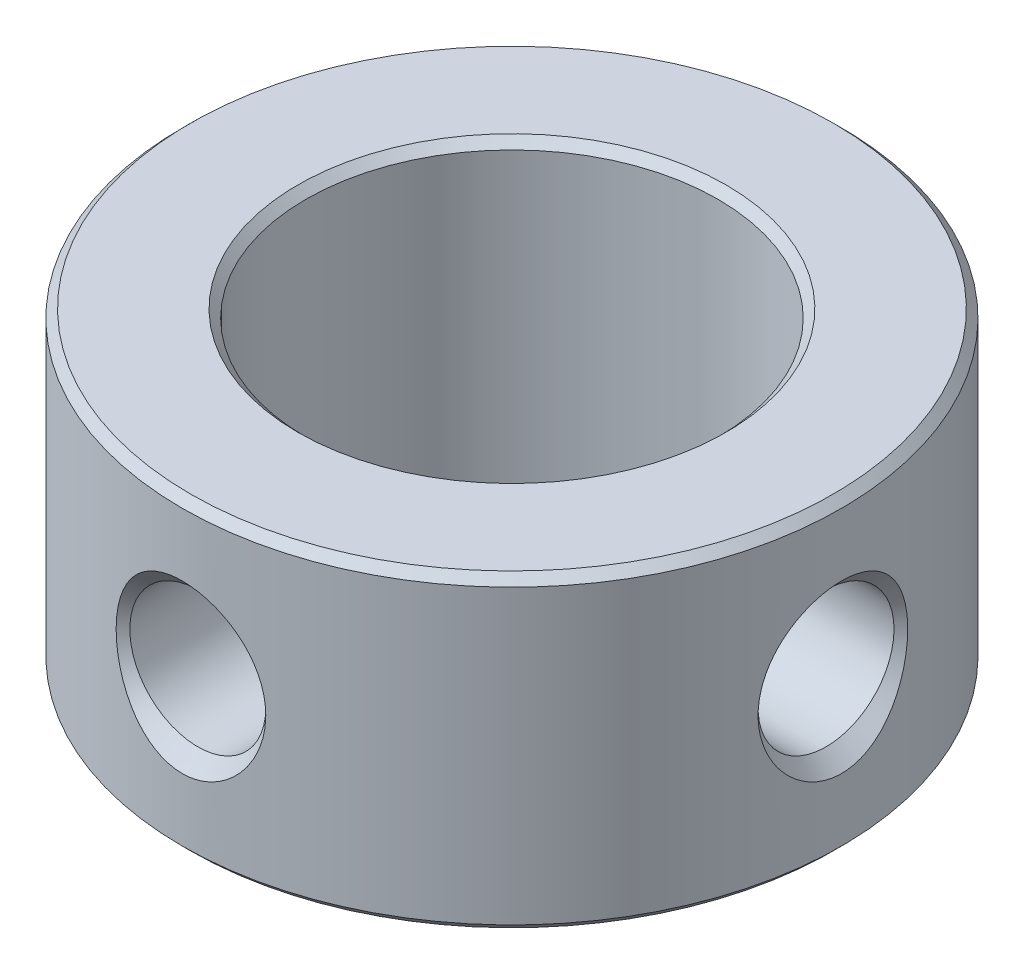
from build123d import *

# Parameters (mm, degrees)
PROFILES_R        = 8
PROFILES_R_2      = 5
PROFILE_DEPTH     = 3.75
CIRPATTERN1_COUNT = 2
CIRPATTERN1_ANGLE = 90
OUTERC_SIZE       = 0.2
INNERC_SIZE       = 0.2


# Read off the part's stored shape, not the designer's step:  Tapped Hole1
with BuildPart() as part:
    # ProfileS → Profile (new, symmetric)
    with BuildSketch(Plane(origin=(0, 0, 0), x_dir=(1, 0, 0), z_dir=(0, 1, 0))):
        with Locations(Location((0, 0, 0), (0, 0, 270))):
            Circle(PROFILES_R)
        with Locations(Location((0, 0, 0), (0, 0, 270))):
            Circle(PROFILES_R_2, mode=Mode.SUBTRACT)
    extrude(amount=PROFILE_DEPTH, both=True)

    # Tapped Hole1 outline → Tapped Hole1 (revolve, cut)
    with BuildSketch(Plane.XZ):
        Polygon((2.025000122, 8.000000122), (0, 8.000000122), (0, 4.719779207), (1.65, 4.719779207), (1.65, 7.625), align=None)
    tapped_hole1 = revolve(axis=Axis((0, 0, 0), (0, 0, 1)), mode=Mode.SUBTRACT)

    # CirPattern1: Tapped Hole1 ×2 about axis
    cirpattern1_axis = Axis((0, 3.75, 0), (0, 1, 0))
    for i in range(1, CIRPATTERN1_COUNT):
        add(tapped_hole1.rotate(cirpattern1_axis, i * CIRPATTERN1_ANGLE / (CIRPATTERN1_COUNT - 1)), mode=Mode.SUBTRACT)

    # OuterC
    outerc_edges = [part.edges().sort_by_distance(p)[0] for p in [
        (0, -3.75, -8),
        (0, 3.75, -8),
    ]]
    chamfer(outerc_edges, length=OUTERC_SIZE)

    # InnerC
    innerc_edges = [part.edges().sort_by_distance(p)[0] for p in [
        (0, -3.75, -5),
        (0, 3.75, -5),
    ]]
    chamfer(innerc_edges, length=INNERC_SIZE)


solid = part.part
